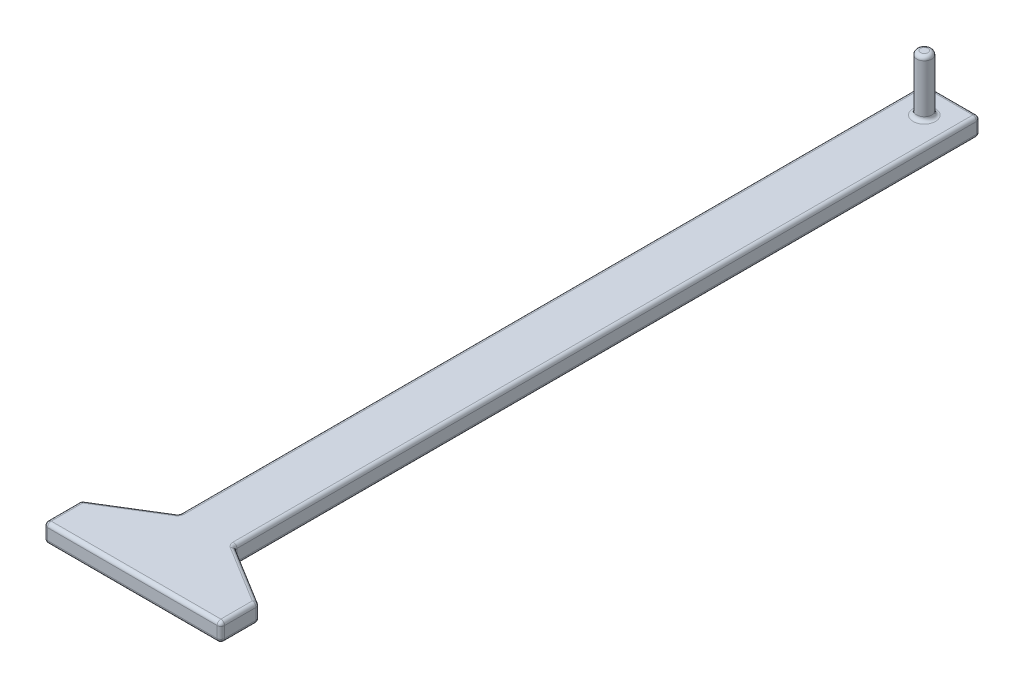
from build123d import *

# Parameters (mm, degrees)
SKETCH1_W           = 15
SKETCH1_H           = 200
SKETCH1_W_2         = 47.5
SKETCH1_H_2         = 10
BOSS_EXTRUDE1_DEPTH = 5
SKETCH4_R           = 2
BOSS_EXTRUDE3_DEPTH = 15
FILLET5_R           = 1
FILLET6_R           = 1


with BuildPart() as part:
    # Sketch1 → Boss-Extrude1 (new body)
    with BuildSketch(Plane(origin=(0, 0, 0), x_dir=(1, 0, 0), z_dir=(0, 1, 0))):
        Polygon((-31.25, -10), (16.25, -10), (0, 0), (-15, 0), align=None)
        with Locations((-7.5, 100)):
            Rectangle(SKETCH1_W, SKETCH1_H)
        with Locations((-7.5, -15)):
            Rectangle(SKETCH1_W_2, SKETCH1_H_2)
    extrude(amount=BOSS_EXTRUDE1_DEPTH)

    # Sketch4 → Boss-Extrude3 (add)
    with BuildSketch(Plane(origin=(0, 5, 0), x_dir=(1, 0, 0), z_dir=(0, 1, 0))):
        with Locations(Location((-7.5, 192.5, 0), (0, 0, 270))):
            Circle(SKETCH4_R)
    extrude(amount=BOSS_EXTRUDE3_DEPTH)

    # Fillet5
    fillet5_edges = [part.edges().sort_by_distance(p)[0] for p in [
        (-31.25, 5, 15),
        (-7.5, 0, -200),
        (0, 0, -100),
        (8.125, 0, 5),
        (16.25, 0, 15),
        (-7.5, 0, 20),
        (-31.25, 0, 15),
        (-23.125, 0, 5),
        (-7.5, 5, 20),
        (-15, 2.5, 0),
        (-15, 2.5, -200),
        (0, 2.5, -200),
        (0, 2.5, 0),
        (16.25, 2.5, 10),
        (-31.25, 2.5, 10),
        (16.25, 5, 15),
        (8.125, 5, 5),
        (-7.5, 5, -194.5),
        (-7.5, 20, -194.5),
        (0, 5, -100),
        (-7.5, 5, -200),
        (-15, 5, -100),
        (-23.125, 5, 5),
        (-15, 0, -100),
    ]]
    fillet(fillet5_edges, radius=FILLET5_R)

    # Fillet6
    # the kernel refuses this fillet: 1 mm, written as the material it takes off along each edge
    with BuildSketch(Plane(origin=(15.25, 4, 19), x_dir=(1, 0, 0), z_dir=(0, 0, 1))) as fillet6_piece_1_section:
        Polygon((0, 0), (FILLET6_R, 0), (FILLET6_R, FILLET6_R), (0, FILLET6_R), align=None)
    fillet6_piece_1 = extrude(amount=FILLET6_R, mode=Mode.PRIVATE)
    fillet6_piece_1 = fillet6_piece_1 - Plane(origin=(15.25, 4, 19), x_dir=(-0.7071067811865475, -0.7071067811865475, 0), z_dir=(0, 0, 1)) * Sphere(FILLET6_R, mode=Mode.PRIVATE)
    add(fillet6_piece_1, mode=Mode.SUBTRACT)
    with BuildSketch(Plane(origin=(15.25, 1, 19), x_dir=(1, 0, 0), z_dir=(0, 0, 1))) as fillet6_piece_2_section:
        Polygon((0, 0), (FILLET6_R, 0), (FILLET6_R, -FILLET6_R), (0, -FILLET6_R), align=None)
    fillet6_piece_2 = extrude(amount=FILLET6_R, mode=Mode.PRIVATE)
    fillet6_piece_2 = fillet6_piece_2 - Plane(origin=(15.25, 1, 19), x_dir=(-0.7071067811865475, 0.7071067811865475, 0), z_dir=(0, 0, 1)) * Sphere(FILLET6_R, mode=Mode.PRIVATE)
    add(fillet6_piece_2, mode=Mode.SUBTRACT)
    with BuildSketch(Plane(origin=(-30.25, 4, 19), x_dir=(0, 0, 1), z_dir=(-1, 0, 0))) as fillet6_piece_3_section:
        Polygon((0, 0), (FILLET6_R, 0), (FILLET6_R, FILLET6_R), (0, FILLET6_R), align=None)
    fillet6_piece_3 = extrude(amount=FILLET6_R, mode=Mode.PRIVATE)
    fillet6_piece_3 = fillet6_piece_3 - Plane(origin=(-30.25, 4, 19), x_dir=(0, -0.7071067811865475, -0.7071067811865475), z_dir=(-1, 0, 0)) * Sphere(FILLET6_R, mode=Mode.PRIVATE)
    add(fillet6_piece_3, mode=Mode.SUBTRACT)
    with BuildSketch(Plane(origin=(-30.25, 1, 19), x_dir=(0, 0, 1), z_dir=(-1, 0, 0))) as fillet6_piece_4_section:
        Polygon((0, 0), (FILLET6_R, 0), (FILLET6_R, -FILLET6_R), (0, -FILLET6_R), align=None)
    fillet6_piece_4 = extrude(amount=FILLET6_R, mode=Mode.PRIVATE)
    fillet6_piece_4 = fillet6_piece_4 - Plane(origin=(-30.25, 1, 19), x_dir=(0, 0.7071067811865475, -0.7071067811865475), z_dir=(-1, 0, 0)) * Sphere(FILLET6_R, mode=Mode.PRIVATE)
    add(fillet6_piece_4, mode=Mode.SUBTRACT)
    with BuildSketch(Plane(origin=(-31.25, 1, 20), x_dir=(0, 0, -1), z_dir=(0, 1, 0)), Plane(origin=(16.25, 1, 20), x_dir=(-1, 0, 0), z_dir=(0, 1, 0))) as fillet6_piece_5:
        with BuildLine():
            CenterArc((FILLET6_R, -FILLET6_R), FILLET6_R, 90, 90)
            Line((0, -FILLET6_R), (0, 0))
            Line((0, 0), (FILLET6_R, 0))
        make_face()
    extrude(amount=3, mode=Mode.SUBTRACT)


solid = part.part
